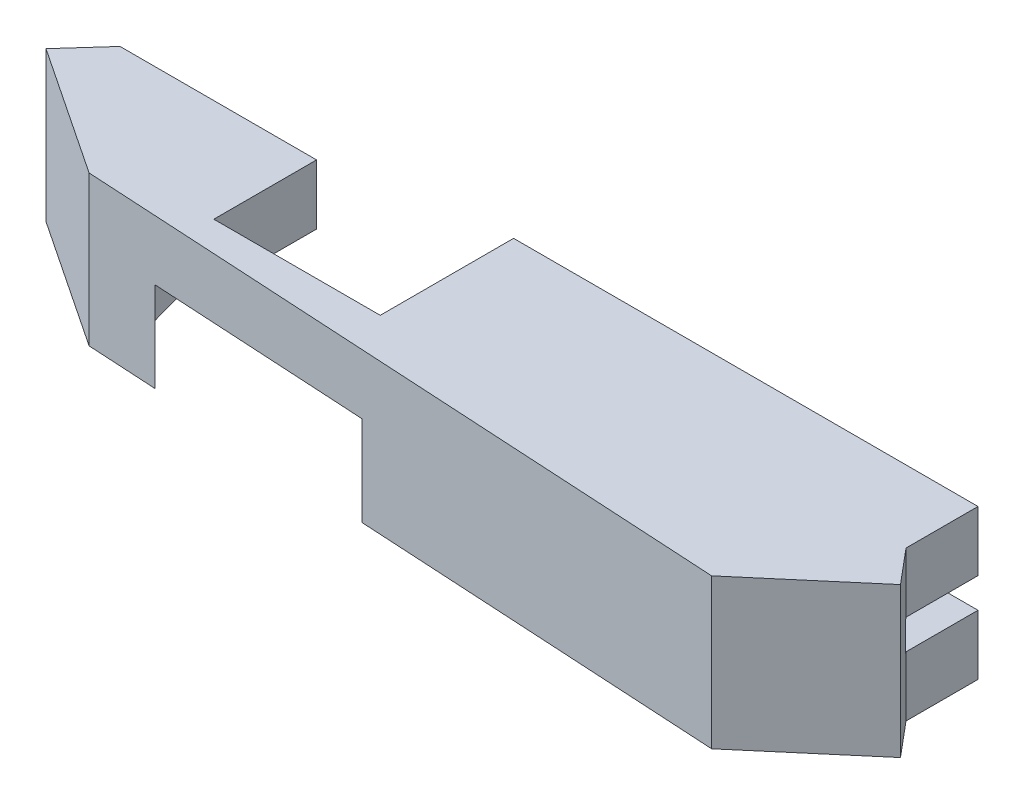
from build123d import *

# Parameters (mm, degrees)
BOSS_EXTRUDE2_DEPTH = 4
BOSS_EXTRUDE3_DEPTH = 2
BOSS_EXTRUDE4_DEPTH = 4
CUT_EXTRUDE1_DEPTH  = 6


with BuildPart() as part:
    # Sketch2 → Boss-Extrude2 (new body)
    with BuildSketch(Plane(origin=(0, 0, 0), x_dir=(1, 0, 0), z_dir=(0, 1, 0))):
        Polygon((5.5, 6.858588715), (-7.617234461, 6.858588715), (-9.959191583, 4.257581826), (-1.338261213, -1.486289651), (42.73, -4), (49.538362829, 1.796672871), (47.61, 4.0948062), (47.61, 8.9), (16.61, 8.9), (16.61, 0), (5.5, 0), align=None)
    extrude(amount=BOSS_EXTRUDE2_DEPTH)

    # Sketch2<9> → Boss-Extrude3 (add)
    with BuildSketch(Plane(origin=(0, 0, 0), x_dir=(1, 0, 0), z_dir=(0, 1, 0))):
        with BuildLine():
            Line((-0.115159211, -0.3), (-7.817973643, 6.635645268))
            Line((-7.817973643, 6.635645268), (-9.959191583, 4.257581826))
            Line((-9.959191583, 4.257581826), (-1.338261213, -1.486289651))
            Line((-1.338261213, -1.486289651), (42.73, -4))
            Line((42.73, -4), (49.538362829, 1.796672871))
            Line((49.538362829, 1.796672871), (47.802836283, 3.864992867))
            Line((47.802836283, 3.864992867), (42.83919107, -0.3))
            Line((42.83919107, -0.3), (34.16881591, -0.3))
            Line((34.16881591, -0.3), (34.16881591, 0.607570661))
            ThreePointArc((34.16881591, 0.607570661), (29.26, 4.2), (24.35118409, 0.607570661))
            Line((24.35118409, 0.607570661), (24.35118409, -0.3))
            Line((24.35118409, -0.3), (-0.115159211, -0.3))
        make_face()
    extrude(amount=-BOSS_EXTRUDE3_DEPTH)

    # Sketch4 → Boss-Extrude4 (add)
    with BuildSketch(Plane(origin=(0, -2, 0), x_dir=(-1, 0, 0), z_dir=(0, -1, 0))):
        Polygon((7.617234461, 6.858588715), (0, 6.858588715), (0, 0), (-24.15118409, 0), (-24.15118409, 8.9), (-47.61, 8.9), (-47.61, 4.0948062), (-49.538362829, 1.796672871), (-42.73, -4), (1.338261213, -1.486289651), (9.959191583, 4.257581826), align=None)
    extrude(amount=BOSS_EXTRUDE4_DEPTH)

    # Sketch5 → Cut-Extrude1 (cut)
    with BuildSketch(Plane(origin=(0, -6, 0), x_dir=(-1, 0, 0), z_dir=(0, -1, 0))):
        Polygon((-24.15118409, 0), (-23.590958237, 0), (-23.590958237, 8.9), (-25.659003688, 8.9), align=None)
        Polygon((-5.5, -3.214115871), (-0.689386067, 0), (-23.590958237, 0), (-16.61, -3.214115871), align=None)
        Polygon((1.904308615, 6.858588715), (-0.689386067, 6.858588715), (-0.689386067, 0), (0, 0), align=None)
    extrude(amount=-CUT_EXTRUDE1_DEPTH, mode=Mode.SUBTRACT)


solid = part.part
